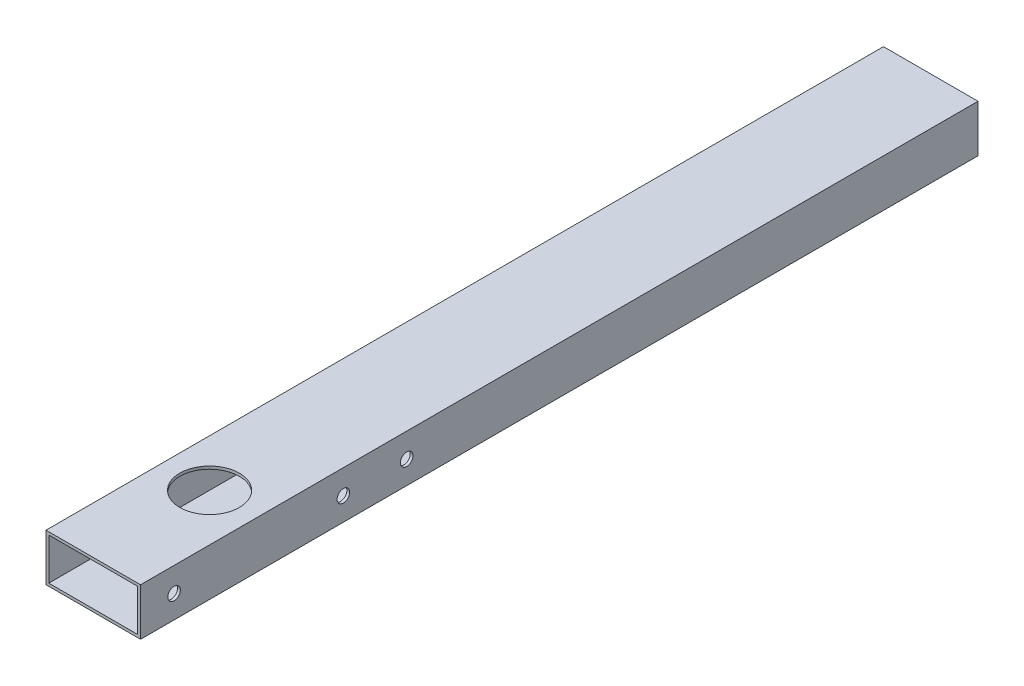
from build123d import *

# Parameters (mm, degrees)
CROQUIS1_W                    = 50.8
CROQUIS1_H                    = 25.4
CROQUIS1_W_2                  = 47.8
CROQUIS1_H_2                  = 22.4
SALIENTE_EXTRUIR1_DEPTH       = 450
CROQUIS2_R                    = 16
CORTAR_EXTRUIR1_DEPTH         = 26
TALADRO_DE_MARGEN_PARA_1_42_D = 6.7564


with BuildPart() as part:
    # Croquis1 → Saliente-Extruir1 (new body)
    with BuildSketch(Plane.XY):
        Rectangle(CROQUIS1_W, CROQUIS1_H)
        Rectangle(CROQUIS1_W_2, CROQUIS1_H_2, mode=Mode.SUBTRACT)
    extrude(amount=SALIENTE_EXTRUIR1_DEPTH)

    # Croquis2 → Cortar-Extruir1 (cut)
    with BuildSketch(Plane(origin=(0, 12.7, 0), x_dir=(1, 0, 0), z_dir=(0, 1, 0))):
        with Locations((0, -387.5)):
            Circle(CROQUIS2_R)
    extrude(amount=-CORTAR_EXTRUIR1_DEPTH, mode=Mode.SUBTRACT)

    # Taladro de margen para 1/42 (through all)
    with Locations(Plane(origin=(-26.4, 572.488619806, 162.989101594), x_dir=(0, -1, 0), z_dir=(-1, 0, 0))):
        with Locations((572.888619806, 269.010898406), (572.888619806, 178.010898406), (572.888619806, 144.010898406)):
            Hole(TALADRO_DE_MARGEN_PARA_1_42_D / 2)


solid = part.part
